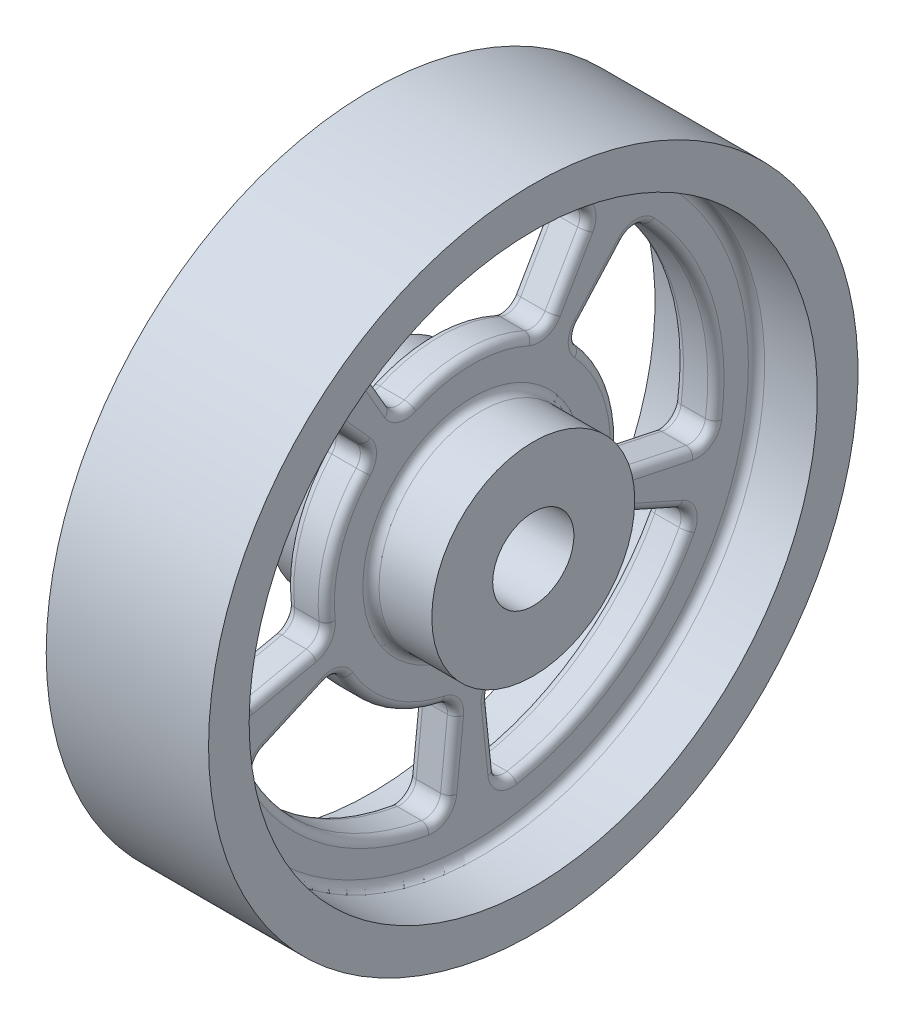
from build123d import *

# Parameters (mm, degrees)
CUT_EXTRUDE1_DEPTH       = 58.933151131
FILLET1_R                = 2
CIRPATTERN1_COUNT        = 5
FILLET1_OF_CIRPATTERN1_R = 2
FILLET2_R                = 1


with BuildPart() as part:
    # Sketch1 → Revolve1 (revolve)
    with BuildSketch(Plane(origin=(0, 0, 0), x_dir=(1, 0, 0), z_dir=(0, 1, 0))):
        Polygon((2.5, 35), (10, 35), (10, 40), (-10, 40), (-10, 35), (-2.5, 35), (-2.5, 12.5), (-10, 12.5), (-10, 5), (10, 5), (10, 12.5), (2.5, 12.5), align=None)
    revolve(axis=Axis((0, 0, 0), (1, 0, 0)))

    # Sketch2 → Cut-Extrude1 (cut, through all)
    with BuildSketch(Plane(origin=(2.5, 0, 0), x_dir=(0, 0, -1), z_dir=(1, 0, 0))):
        with BuildLine():
            Line((-9, 15.588457268), (-15, 25.980762114))
            ThreePointArc((-15, 25.980762114), (0, 30), (15, 25.980762114))
            Line((15, 25.980762114), (9, 15.588457268))
            ThreePointArc((9, 15.588457268), (0, 18), (-9, 15.588457268))
        make_face()
    cut_extrude1 = extrude(amount=-CUT_EXTRUDE1_DEPTH, mode=Mode.SUBTRACT)

    # Fillet1
    fillet1_edges = [part.edges().sort_by_distance(p)[0] for p in [
        (0, 25.980762114, -15),
        (0, 15.588457268, -9),
        (0, 25.980762114, 15),
        (0, 15.588457268, 9),
    ]]
    fillet(fillet1_edges, radius=FILLET1_R)

    # CirPattern1: Cut-Extrude1 ×5 about axis
    cirpattern1_axis = Axis((0, 0, 0), (-1, 0, 0))
    for i in range(1, CIRPATTERN1_COUNT):
        add(cut_extrude1.rotate(cirpattern1_axis, i * 360 / CIRPATTERN1_COUNT), mode=Mode.SUBTRACT)

    # Fillet1 of CirPattern1
    fillet1_of_cirpattern1_edges = [part.edges().sort_by_distance(p)[0] for p in [
        (0, -6.237350725, -29.344428022),
        (0, -3.742410435, -17.606656813),
        (0, 22.294344764, -20.073918191),
        (0, 13.376606859, -12.044350914),
        (0, -29.835656861, -3.135853898),
        (0, -17.901394117, -1.881512339),
        (0, -12.202099292, -27.406363729),
        (0, -7.321259575, -16.443818238),
        (0, -12.202099292, 27.406363729),
        (0, -7.321259575, 16.443818238),
        (0, -29.835656861, 3.135853898),
        (0, -17.901394117, 1.881512339),
        (0, 22.294344764, 20.073918191),
        (0, 13.376606859, 12.044350914),
        (0, -6.237350725, 29.344428022),
        (0, -3.742410435, 17.606656813),
    ]]
    fillet(fillet1_of_cirpattern1_edges, radius=FILLET1_OF_CIRPATTERN1_R)

    # Fillet2
    fillet2_edges = [part.edges().sort_by_distance(p)[0] for p in [
        (-2.5, 0, 35),
        (-2.5, 0, 12.5),
        (-2.5, 25.773119483, -14.14430798),
        (-2.5, 20.710230592, -11.957057207),
        (-2.5, 16.330173087, -8.831526428),
        (-2.5, 18, 0),
        (-2.5, 16.330173087, 8.831526428),
        (-2.5, 20.710230592, 11.957057207),
        (-2.5, 25.773119483, 14.14430798),
        (-2.5, 30, 0),
        (-2.5, -5.487704354, -28.882524769),
        (-2.5, -4.972023962, -23.391533639),
        (-2.5, -3.352979753, -18.260009279),
        (-2.5, 5.562305899, -17.119017293),
        (-2.5, 13.445581763, -12.801825774),
        (-2.5, 17.771650383, -16.001665879),
        (-2.5, 21.416368191, -20.14086169),
        (-2.5, 9.270509831, -28.531695489),
        (-2.5, -29.164707294, -3.706074009),
        (-2.5, -23.783110394, -2.49970563),
        (-2.5, -18.402428538, -2.453779941),
        (-2.5, -14.562305899, -10.580134541),
        (-2.5, -8.020346559, -16.743489875),
        (-2.5, -9.726746619, -21.846630597),
        (-2.5, -12.537076026, -26.592045067),
        (-2.5, -24.270509831, -17.633557569),
        (-2.5, -12.537076026, 26.592045067),
        (-2.5, -9.726746619, 21.846630597),
        (-2.5, -8.020346559, 16.743489875),
        (-2.5, -14.562305899, 10.580134541),
        (-2.5, -18.402428538, 2.453779941),
        (-2.5, -23.783110394, 2.49970563),
        (-2.5, -29.164707294, 3.706074009),
        (-2.5, -24.270509831, 17.633557569),
        (-2.5, 21.416368191, 20.14086169),
        (-2.5, 17.771650383, 16.001665879),
        (-2.5, 13.445581763, 12.801825774),
        (-2.5, 5.562305899, 17.119017293),
        (-2.5, -3.352979753, 18.260009279),
        (-2.5, -4.972023962, 23.391533639),
        (-2.5, -5.487704354, 28.882524769),
        (-2.5, 9.270509831, 28.531695489),
        (2.5, 0, 12.5),
        (2.5, 0, 35),
        (2.5, 25.773119483, -14.14430798),
        (2.5, 30, 0),
        (2.5, 25.773119483, 14.14430798),
        (2.5, 20.710230592, 11.957057207),
        (2.5, 16.330173087, 8.831526428),
        (2.5, 18, 0),
        (2.5, 16.330173087, -8.831526428),
        (2.5, 20.710230592, -11.957057207),
        (2.5, -5.487704354, -28.882524769),
        (2.5, 9.270509831, -28.531695489),
        (2.5, 21.416368191, -20.14086169),
        (2.5, 17.771650383, -16.001665879),
        (2.5, 13.445581763, -12.801825774),
        (2.5, 5.562305899, -17.119017293),
        (2.5, -3.352979753, -18.260009279),
        (2.5, -4.972023962, -23.391533639),
        (2.5, -29.164707294, -3.706074009),
        (2.5, -24.270509831, -17.633557569),
        (2.5, -12.537076026, -26.592045067),
        (2.5, -9.726746619, -21.846630597),
        (2.5, -8.020346559, -16.743489875),
        (2.5, -14.562305899, -10.580134541),
        (2.5, -18.402428538, -2.453779941),
        (2.5, -23.783110394, -2.49970563),
        (2.5, -12.537076026, 26.592045067),
        (2.5, -24.270509831, 17.633557569),
        (2.5, -29.164707294, 3.706074009),
        (2.5, -23.783110394, 2.49970563),
        (2.5, -18.402428538, 2.453779941),
        (2.5, -14.562305899, 10.580134541),
        (2.5, -8.020346559, 16.743489875),
        (2.5, -9.726746619, 21.846630597),
        (2.5, 21.416368191, 20.14086169),
        (2.5, 9.270509831, 28.531695489),
        (2.5, -5.487704354, 28.882524769),
        (2.5, -4.972023962, 23.391533639),
        (2.5, -3.352979753, 18.260009279),
        (2.5, 5.562305899, 17.119017293),
        (2.5, 13.445581763, 12.801825774),
        (2.5, 17.771650383, 16.001665879),
    ]]
    fillet(fillet2_edges, radius=FILLET2_R)


solid = part.part
